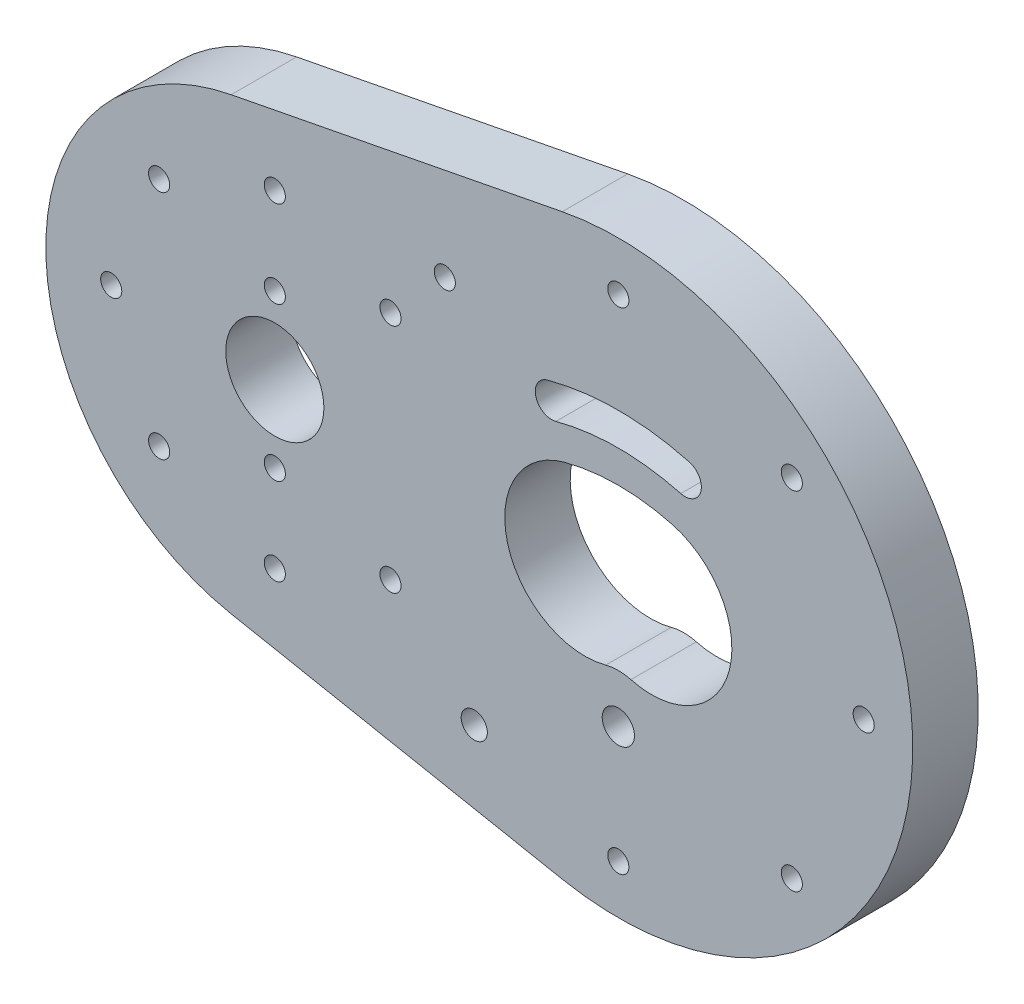
from build123d import *

# Parameters (mm, degrees)
SKETCH1_W                    = 127
SKETCH1_H                    = 88.9
SKETCH1_R                    = 1.564880276
SKETCH1_R_2                  = 4.7625
BOSS_EXTRUDE1_DEPTH          = 6.35
SKETCH2_W                    = 177.519600035
SKETCH2_H                    = 126.718171086
CUT_EXTRUDE1_DEPTH           = 108.988931327
SKETCH4_R                    = 0.635
SKETCH4_R_2                  = 1.27
CUT_EXTRUDE2_DEPTH           = 70.387819761
SKETCH5_R                    = 0.635
CUT_EXTRUDE3_DEPTH           = 70.387819761
M2_5X0_45_TAPPED_HOLE2_D     = 2.05
M2_5X0_45_TAPPED_HOLE2_DEPTH = 7.366
M2_5X0_45_TAPPED_HOLE2_TIP   = 0.615882135


with BuildPart() as part:
    # Sketch1 → Boss-Extrude1 (new body)
    with BuildSketch(Plane.XY):
        with Locations((-28.03132955, 12.5)):
            Rectangle(SKETCH1_W, SKETCH1_H)
        Circle(SKETCH1_R, mode=Mode.SUBTRACT)
        with Locations((-33.3375, 12.5)):
            Circle(SKETCH1_R_2, mode=Mode.SUBTRACT)
        with BuildLine():
            ThreePointArc((5.250170212, 19.593901979), (10.755067214, 10.059140681), (1.220305916, 4.554243678))
            ThreePointArc((1.220305916, 4.554243678), (0, 4.7149), (-1.220305916, 4.554243678))
            ThreePointArc((-1.220305916, 4.554243678), (-10.755067214, 10.059140681), (-5.250170212, 19.593901979))
            ThreePointArc((-5.250170212, 19.593901979), (0, 20.2851), (5.250170212, 19.593901979))
        make_face(mode=Mode.SUBTRACT)
        with BuildLine():
            ThreePointArc((6.881351362, 25.681552906), (0, 26.5875), (-6.881351362, 25.681552906))
            ThreePointArc((-6.881351362, 25.681552906), (-8.003883377, 23.737270423), (-6.059600893, 22.614738408))
            ThreePointArc((-6.059600893, 22.614738408), (0, 23.4125), (6.059600893, 22.614738408))
            ThreePointArc((6.059600893, 22.614738408), (8.003883377, 23.737270423), (6.881351362, 25.681552906))
        make_face(mode=Mode.SUBTRACT)
    extrude(amount=BOSS_EXTRUDE1_DEPTH)

    # Sketch2 → Cut-Extrude1 (cut, through all)
    with BuildSketch(Plane.XY.offset(6.35)):
        with Locations((-18.257651528, 17.008273159)):
            Rectangle(SKETCH2_W, SKETCH2_H)
        with BuildLine():
            Line((-37.570833333, 34.318100602), (-5.442857143, 40.551843631))
            ThreePointArc((-5.442857143, 40.551843631), (28.575, 12.5), (-5.442857143, -15.551843631))
            Line((-5.442857143, -15.551843631), (-37.570833333, -9.318100602))
            ThreePointArc((-37.570833333, -9.318100602), (-55.5625, 12.5), (-37.570833333, 34.318100602))
        make_face(mode=Mode.SUBTRACT)
    extrude(amount=-CUT_EXTRUDE1_DEPTH, mode=Mode.SUBTRACT)

    # Sketch4 → Cut-Extrude2 (cut, through all)
    with BuildSketch(Plane.XY.offset(6.35)):
        with Locations((-33.3375, 28.375)):
            Circle(SKETCH4_R)
        with Locations((0, 36.3125)):
            Circle(SKETCH4_R)
        with Locations((-22.112179849, 23.725320151)):
            Circle(SKETCH4_R)
        with Locations((-13.982083803, -6.855416197)):
            Circle(SKETCH4_R_2)
        with Locations((-22.112179849, 1.274679849)):
            Circle(SKETCH4_R)
        with Locations((-33.3375, -3.375)):
            Circle(SKETCH4_R)
        with Locations((-44.562820151, 1.274679849)):
            Circle(SKETCH4_R)
        with Locations((-49.2125, 12.5)):
            Circle(SKETCH4_R)
        with Locations((16.837980227, 29.337980227)):
            Circle(SKETCH4_R)
        with Locations((23.8125, 12.5)):
            Circle(SKETCH4_R)
        with Locations((16.837980227, -4.337980227)):
            Circle(SKETCH4_R)
        with Locations((0, -11.3125)):
            Circle(SKETCH4_R)
        with Locations((-44.562820151, 23.725320151)):
            Circle(SKETCH4_R)
        with Locations((-16.837980227, 29.337980227)):
            Circle(SKETCH4_R)
    extrude(amount=-CUT_EXTRUDE2_DEPTH, mode=Mode.SUBTRACT)

    # Sketch5 → Cut-Extrude3 (cut, through all)
    with BuildSketch(Plane.XY.offset(6.35)):
        with Locations((-33.3375, 19.9422)):
            Circle(SKETCH5_R)
        with Locations((-33.3375, 5.0578)):
            Circle(SKETCH5_R)
    extrude(amount=-CUT_EXTRUDE3_DEPTH, mode=Mode.SUBTRACT)

    # M2.5x0.45 Tapped Hole2
    with Locations(Plane(origin=(-44.562820151, 23.725320151, 6.35), x_dir=(1, 0, 0), z_dir=(0, 0, 1))):
        with Locations((0, 0), (-4.649679849, -11.225320151), (0, -22.450640302), (11.225320151, -27.100320151), (22.450640302, -22.450640302), (22.450640302, 0), (11.225320151, 4.649679849), (27.724839924, 5.612660076), (61.400800378, 5.612660076), (68.375320151, -11.225320151), (61.400800378, -28.063300378), (44.562820151, -35.037820151), (44.562820151, 12.587179849), (11.225320151, -3.783120151), (11.225320151, -18.667520151)):
            Hole(M2_5X0_45_TAPPED_HOLE2_D / 2, depth=M2_5X0_45_TAPPED_HOLE2_DEPTH)
            with Locations((0, 0, -(M2_5X0_45_TAPPED_HOLE2_DEPTH + M2_5X0_45_TAPPED_HOLE2_TIP / 2))):  # 118° drill point
                Cone(0, M2_5X0_45_TAPPED_HOLE2_D / 2, M2_5X0_45_TAPPED_HOLE2_TIP, mode=Mode.SUBTRACT)


solid = part.part
